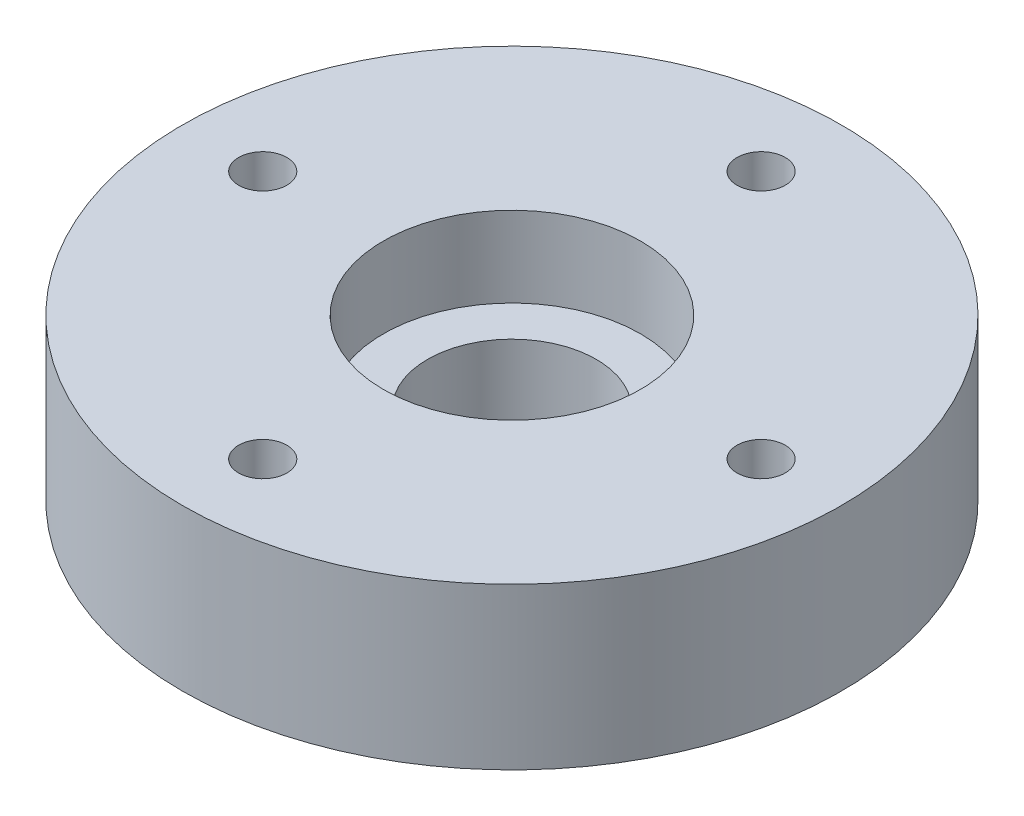
from build123d import *

# Parameters (mm, degrees)
SKETCH1_R           = 20.5
SKETCH1_R_2         = 5.25
BOSS_EXTRUDE1_DEPTH = 10
SKETCH2_R           = 8
CUT_EXTRUDE1_DEPTH  = 5
SKETCH5_R           = 1.5
CUT_EXTRUDE2_DEPTH  = 10


with BuildPart() as part:
    # Sketch1 → Boss-Extrude1 (new body)
    with BuildSketch(Plane(origin=(0, 0, 0), x_dir=(1, 0, 0), z_dir=(0, 1, 0))):
        Circle(SKETCH1_R)
        Circle(SKETCH1_R_2, mode=Mode.SUBTRACT)
    extrude(amount=BOSS_EXTRUDE1_DEPTH)

    # Sketch2 → Cut-Extrude1 (cut)
    with BuildSketch(Plane(origin=(0, 10, 0), x_dir=(1, 0, 0), z_dir=(0, 1, 0))):
        Circle(SKETCH2_R)
    extrude(amount=-CUT_EXTRUDE1_DEPTH, mode=Mode.SUBTRACT)

    # Sketch5 → Cut-Extrude2 (cut)
    with BuildSketch(Plane(origin=(0, 10, 0), x_dir=(1, 0, 0), z_dir=(0, 1, 0))):
        with Locations((0, 15.5)):
            Circle(SKETCH5_R)
        with Locations((15.5, 0)):
            Circle(SKETCH5_R)
        with Locations((0, -15.5)):
            Circle(SKETCH5_R)
        with Locations((-15.5, 0)):
            Circle(SKETCH5_R)
    extrude(amount=-CUT_EXTRUDE2_DEPTH, mode=Mode.SUBTRACT)


solid = part.part
